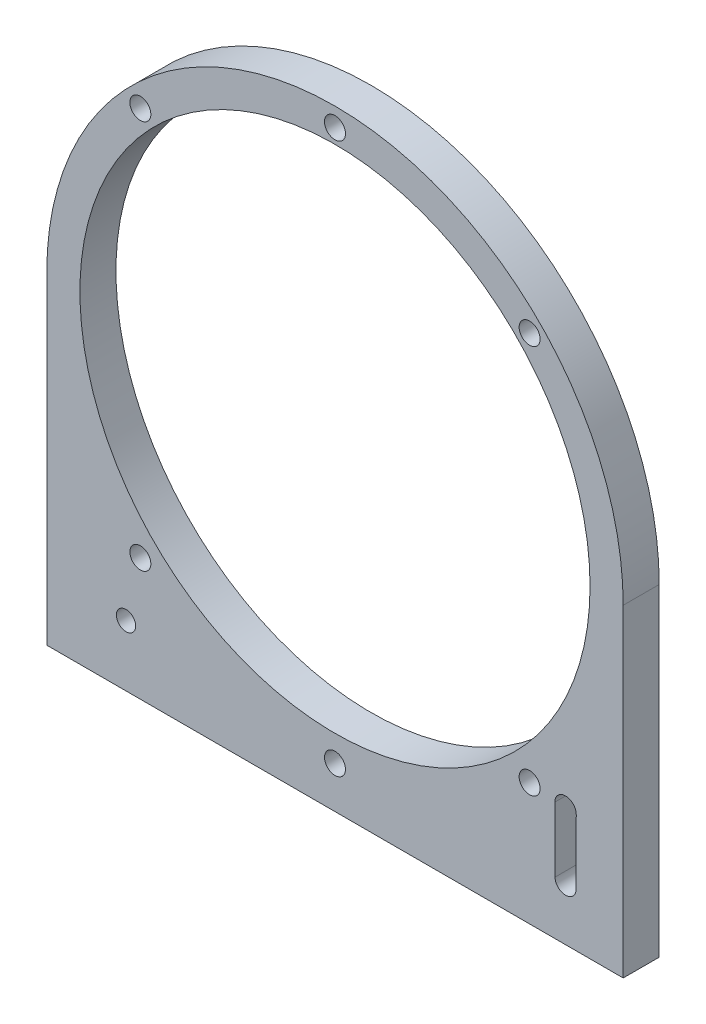
from build123d import *

# Parameters (mm, degrees)
SKETCH1_R                = 44.958
BOSS_EXTRUDE1_DEPTH      = 6.35
M3_CLEARANCE_HOLE2_D     = 3.4
M3_CLEARANCE_HOLE2_DEPTH = 25.4
M3_CLEARANCE_HOLE2_TIP   = 1.021463052
M3_CLEARANCE_HOLE3_D     = 3.7
M3_CLEARANCE_HOLE3_DEPTH = 25.4
M3_CLEARANCE_HOLE3_TIP   = 1.111592145
CUT_EXTRUDE1_START       = -6.35
CUT_EXTRUDE1_DEPTH       = 6.35


# Read off the part's stored shape, not the designer's step: Cut-Extrude1
with BuildPart() as part:
    # Sketch1 → Boss-Extrude1 (new body)
    with BuildSketch(Plane.XY):
        with BuildLine():
            Line((50.8, 0), (50.8, 56.896))
            ThreePointArc((50.8, 56.896), (0, 107.696), (-50.8, 56.896))
            Line((-50.8, 56.896), (-50.8, 0))
            Line((-50.8, 0), (50.8, 0))
        make_face()
        with Locations((0, 56.896)):
            Circle(SKETCH1_R, mode=Mode.SUBTRACT)
    extrude(amount=-BOSS_EXTRUDE1_DEPTH)

    # M3 Clearance Hole2
    with Locations(Plane.XY):
        with Locations((-36.83, 10.7442)):
            Hole(M3_CLEARANCE_HOLE2_D / 2, depth=M3_CLEARANCE_HOLE2_DEPTH)
            with Locations((0, 0, -(M3_CLEARANCE_HOLE2_DEPTH + M3_CLEARANCE_HOLE2_TIP / 2))):  # 118° drill point
                Cone(0, M3_CLEARANCE_HOLE2_D / 2, M3_CLEARANCE_HOLE2_TIP, mode=Mode.SUBTRACT)

    # M3 Clearance Hole3
    with Locations(Plane.XY):
        with Locations((0, 104.394), (34.304578382, 90.184578382), (34.304578383, 21.575421618), (0, 7.366), (-34.304578382, 21.575421618), (-34.304578382, 90.184578382)):
            Hole(M3_CLEARANCE_HOLE3_D / 2, depth=M3_CLEARANCE_HOLE3_DEPTH)
            with Locations((0, 0, -(M3_CLEARANCE_HOLE3_DEPTH + M3_CLEARANCE_HOLE3_TIP / 2))):  # 118° drill point
                Cone(0, M3_CLEARANCE_HOLE3_D / 2, M3_CLEARANCE_HOLE3_TIP, mode=Mode.SUBTRACT)

    # Cut-Extrude1 outline → Cut-Extrude1 (cut)
    with BuildSketch(Plane.XY.offset(CUT_EXTRUDE1_START)):
        with BuildLine():
            Line((42.49, 9.398), (42.525, 20.828))
            ThreePointArc((42.525, 20.828), (40.64, 22.713), (38.755, 20.828))
            Line((38.755, 20.828), (38.79, 9.398))
            ThreePointArc((38.79, 9.398), (40.64, 7.548), (42.49, 9.398))
        make_face()
    extrude(amount=CUT_EXTRUDE1_DEPTH, mode=Mode.SUBTRACT)


solid = part.part
